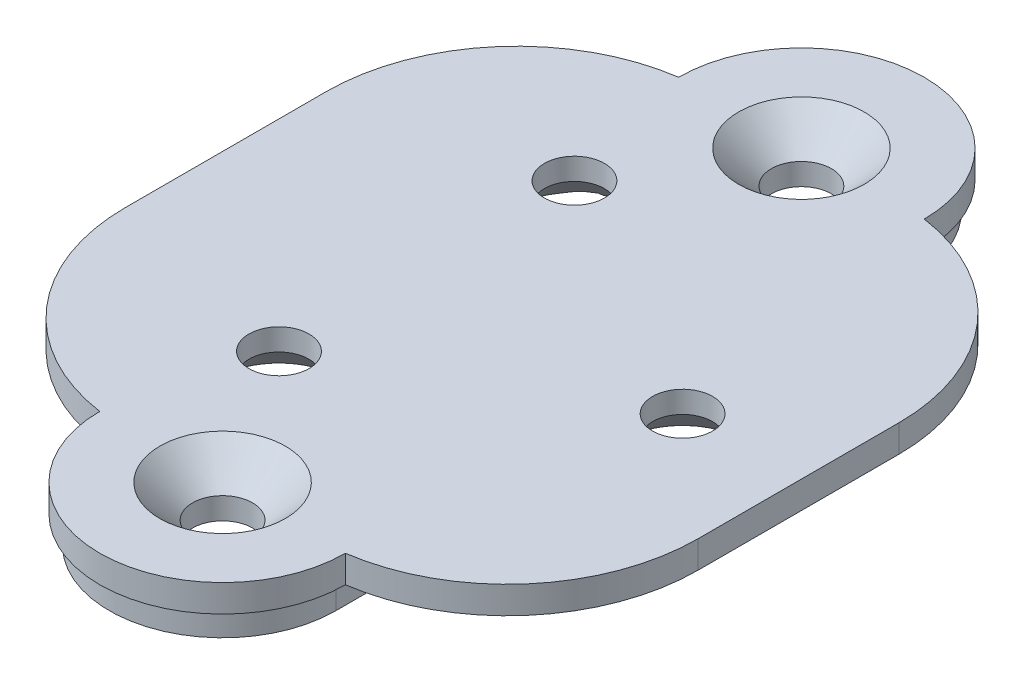
from build123d import *

# Parameters (mm, degrees)
BOSS_EXTRUDE1_DEPTH                          = 2
CSK_FOR_M2_COUNTERSUNK_FLAT_HEAD_SCR_4_COUNT = 2
CSK_FOR_M2_COUNTERSUNK_FLAT_HEAD_SCR_4_PITCH = 10.825317547
CSK_FOR_M2_COUNTERSUNK_FLAT_HEAD_SCR_5_COUNT = 2
CSK_FOR_M2_COUNTERSUNK_FLAT_HEAD_SCR_5_PITCH = 10.825317547
BOSS_EXTRUDE2_START                          = -1
BOSS_EXTRUDE2_DEPTH                          = 1
FILLET1_R                                    = 7
CUT_EXTRUDE1_DEPTH                           = 1


# Read off the part's stored shape, not the designer's step: CSK for M2 Countersunk Flat Head Screw1
with BuildPart() as part:
    # Sketch1 → Boss-Extrude1 (new body)
    with BuildSketch(Plane(origin=(0, 0, 0), x_dir=(1, 0, 0), z_dir=(0, 1, 0))):
        with BuildLine():
            Line((4.5, 10.60416551), (4.5, 7.50416551))
            ThreePointArc((4.5, 7.50416551), (8.75, 0), (4.5, -7.50416551))
            Line((4.5, -7.50416551), (4.5, -10.60416551))
            ThreePointArc((4.5, -10.60416551), (0, -15.10416551), (-4.5, -10.60416551))
            Line((-4.5, -10.60416551), (-4.5, -7.50416551))
            ThreePointArc((-4.5, -7.50416551), (-8.75, 0), (-4.5, 7.50416551))
            Line((-4.5, 7.50416551), (-4.5, 10.60416551))
            ThreePointArc((-4.5, 10.60416551), (0, 15.10416551), (4.5, 10.60416551))
        make_face()
    extrude(amount=BOSS_EXTRUDE1_DEPTH)

    # CSK for M2 Countersunk Flat Head Scr 2 → CSK for M2 Countersunk Flat Head Screw1 (revolve, cut)
    with BuildSketch(Plane.XY.offset(10.60416551)):
        Polygon((0, 0), (1.1, 0), (1.1, 0.8), (2.3, 2), (0, 2), align=None)
    revolve(axis=Axis((0, 0, 10.60416551), (0, 1, 0)), mode=Mode.SUBTRACT)

    # CSK for M2 Countersunk Flat Head Scr 3 o → CSK for M2 Countersunk Flat Head Scr 3 (revolve, cut)
    with BuildSketch(Plane.XY.offset(-10.60416551)):
        Polygon((0, 0), (1.1, 0), (1.1, 0.8), (2.3, 2), (0, 2), align=None)
    revolve(axis=Axis((0, 0, -10.60416551), (0, 1, 0)), mode=Mode.SUBTRACT)

    # Sketch6 → CSK for M2 Countersunk Flat Head Screw2 (revolve, cut)
    with BuildSketch(Plane(origin=(6.25, 0, 0), x_dir=(0, 0, -1), z_dir=(1, 0, 0))):
        Polygon((0, 0), (0, 2), (1.1, 2), (1.1, 1.2), (2.3, 0), align=None)
    csk_for_m2_countersunk_flat_head_screw2 = revolve(axis=Axis((6.25, -6.35, 0), (0, 1, 0)), mode=Mode.SUBTRACT)

    # CSK for M2 Countersunk Flat Head Scr 4: CSK for M2 Countersunk Flat Head Screw2 ×2
    with Locations(*[Vector(-0.8660254037844379, 0, -0.5000000000000012) * (i * CSK_FOR_M2_COUNTERSUNK_FLAT_HEAD_SCR_4_PITCH) for i in range(1, CSK_FOR_M2_COUNTERSUNK_FLAT_HEAD_SCR_4_COUNT)]):
        add(csk_for_m2_countersunk_flat_head_screw2, mode=Mode.SUBTRACT)

    # CSK for M2 Countersunk Flat Head Scr 5: CSK for M2 Countersunk Flat Head Screw2 ×2
    with Locations(*[Vector(-0.8660254037844383, 0, 0.5000000000000008) * (i * CSK_FOR_M2_COUNTERSUNK_FLAT_HEAD_SCR_5_PITCH) for i in range(1, CSK_FOR_M2_COUNTERSUNK_FLAT_HEAD_SCR_5_COUNT)]):
        add(csk_for_m2_countersunk_flat_head_screw2, mode=Mode.SUBTRACT)

    # Sketch7 → Boss-Extrude2 (add)
    with BuildSketch(Plane(origin=(0, 2, 0), x_dir=(1, 0, 0), z_dir=(0, 1, 0)).offset(BOSS_EXTRUDE2_START)):
        with BuildLine():
            Line((4.5, 10.60416551), (10.5, 10.60416551))
            Line((10.5, 10.60416551), (10.5, -10.60416551))
            Line((10.5, -10.60416551), (4.5, -10.60416551))
            Line((4.5, -10.60416551), (4.5, -7.50416551))
            ThreePointArc((4.5, -7.50416551), (8.75, 0), (4.5, 7.50416551))
            Line((4.5, 7.50416551), (4.5, 10.60416551))
        make_face()
        with BuildLine():
            Line((-4.5, -7.50416551), (-4.5, -10.60416551))
            Line((-4.5, -10.60416551), (-10.5, -10.60416551))
            Line((-10.5, -10.60416551), (-10.5, 10.60416551))
            Line((-10.5, 10.60416551), (-4.5, 10.60416551))
            Line((-4.5, 10.60416551), (-4.5, 7.50416551))
            ThreePointArc((-4.5, 7.50416551), (-8.75, 0), (-4.5, -7.50416551))
        make_face()
    extrude(amount=BOSS_EXTRUDE2_DEPTH)

    # Fillet1
    # the kernel refuses this fillet: 7 mm, written as the material it takes off along each edge
    with BuildSketch(Plane(origin=(-10.5, -16.320508076, -10.60416551), x_dir=(1, 0, 0), z_dir=(0, 1, 0))) as fillet1_piece_1:
        with BuildLine():
            CenterArc((7, -6.92820323), FILLET1_R, 98.213210702, 81.786789298)
            Line((0, -6.92820323), (-0.14, -6.92820323))
            Line((-0.14, -6.92820323), (-0.14, 0))
            Line((-0.14, 0), (0, 0.14))
            ThreePointArc((0, 0.14), (3, 0.14), (5.98, 0.138564065))
            Line((5.98, 0.138564065), (6, 0))
        make_face()
    extrude(amount=35.641016151, mode=Mode.SUBTRACT)
    with BuildSketch(Plane(origin=(-10.5, -16.320508076, 10.60416551), x_dir=(1, 0, 0), z_dir=(0, 1, 0)), Plane(origin=(10.5, -16.320508076, -10.60416551), x_dir=(-1, 0, 0), z_dir=(0, 1, 0))) as fillet1_piece_2:
        with BuildLine():
            CenterArc((7, 6.92820323), FILLET1_R, 180, 81.786789298)
            Line((0, 6.92820323), (-0.14, 6.92820323))
            Line((-0.14, 6.92820323), (-0.14, 0))
            Line((-0.14, 0), (0, -0.14))
            ThreePointArc((0, -0.14), (3, -0.14), (5.98, -0.138564065))
            Line((5.98, -0.138564065), (6, 0))
        make_face()
    extrude(amount=35.641016151, mode=Mode.SUBTRACT)
    with BuildSketch(Plane(origin=(10.5, -16.320508076, 10.60416551), x_dir=(0, 0, -1), z_dir=(0, 1, 0))) as fillet1_piece_3:
        with BuildLine():
            CenterArc((6.92820323, 7), FILLET1_R, 188.213210702, 81.786789298)
            Line((0, 6), (-0.138564065, 5.98))
            ThreePointArc((-0.138564065, 5.98), (-0.14, 3), (-0.14, 0))
            Line((-0.14, 0), (0, -0.14))
            Line((0, -0.14), (6.92820323, -0.14))
            Line((6.92820323, -0.14), (6.92820323, 0))
        make_face()
    extrude(amount=35.641016151, mode=Mode.SUBTRACT)

    # Sketch8 → Cut-Extrude1 (cut)
    with BuildSketch(Plane.XZ):
        with BuildLine():
            Line((-4.5, -10.60416551), (-4.5, -7.50416551))
            ThreePointArc((-4.5, -7.50416551), (-8.75, 0), (-4.5, 7.50416551))
            Line((-4.5, 7.50416551), (-4.5, 10.60416551))
            ThreePointArc((-4.5, 10.60416551), (0, 15.10416551), (4.5, 10.60416551))
            Line((4.5, 10.60416551), (4.5, 7.50416551))
            ThreePointArc((4.5, 7.50416551), (8.75, 0), (4.5, -7.50416551))
            Line((4.5, -7.50416551), (4.5, -10.60416551))
            ThreePointArc((4.5, -10.60416551), (0, -15.10416551), (-4.5, -10.60416551))
        make_face()
        with BuildLine():
            Line((4.15, 7.3032527), (4.15, 10.60416551))
            ThreePointArc((4.15, 10.60416551), (0, 14.75416551), (-4.15, 10.60416551))
            Line((-4.15, 10.60416551), (-4.15, 7.3032527))
            ThreePointArc((-4.15, 7.3032527), (-8.4, 0), (-4.15, -7.3032527))
            Line((-4.15, -7.3032527), (-4.15, -10.60416551))
            ThreePointArc((-4.15, -10.60416551), (0, -14.75416551), (4.15, -10.60416551))
            Line((4.15, -10.60416551), (4.15, -7.3032527))
            ThreePointArc((4.15, -7.3032527), (8.4, 0), (4.15, 7.3032527))
        make_face(mode=Mode.SUBTRACT)
    extrude(amount=-CUT_EXTRUDE1_DEPTH, mode=Mode.SUBTRACT)


solid = part.part
